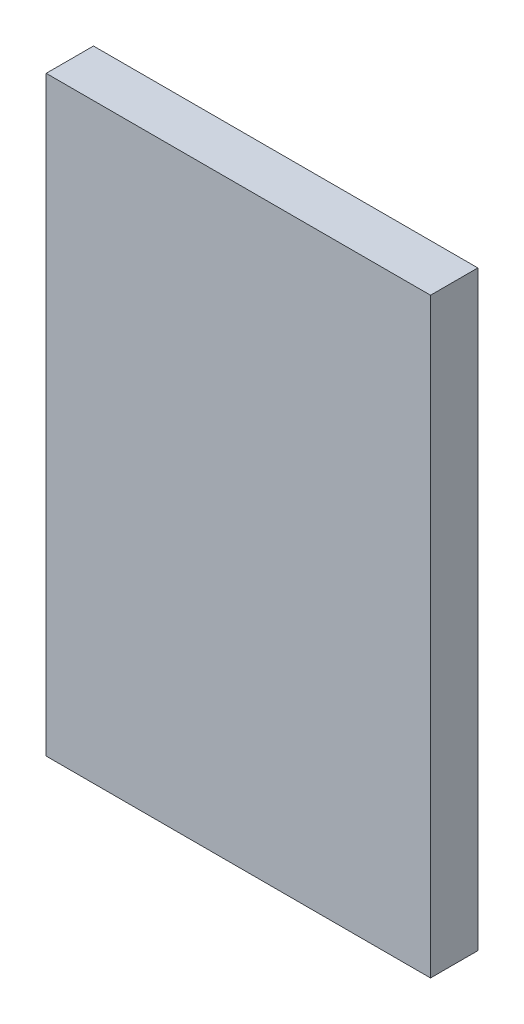
from build123d import *

# Parameters (mm, degrees)
SKETCH_1_W             = 65
SKETCH_1_H             = 100
SM_BASE_FLANGE_1_DEPTH = 8


# Sheet-metal steps are written as plain solids
with BuildPart() as part:
    # Sketch 1 → 基体-法兰1 (new body)
    with BuildSketch(Plane.XY):
        with Locations((32.5, 50)):
            Rectangle(SKETCH_1_W, SKETCH_1_H)
    extrude(amount=-SM_BASE_FLANGE_1_DEPTH)


solid = part.part
